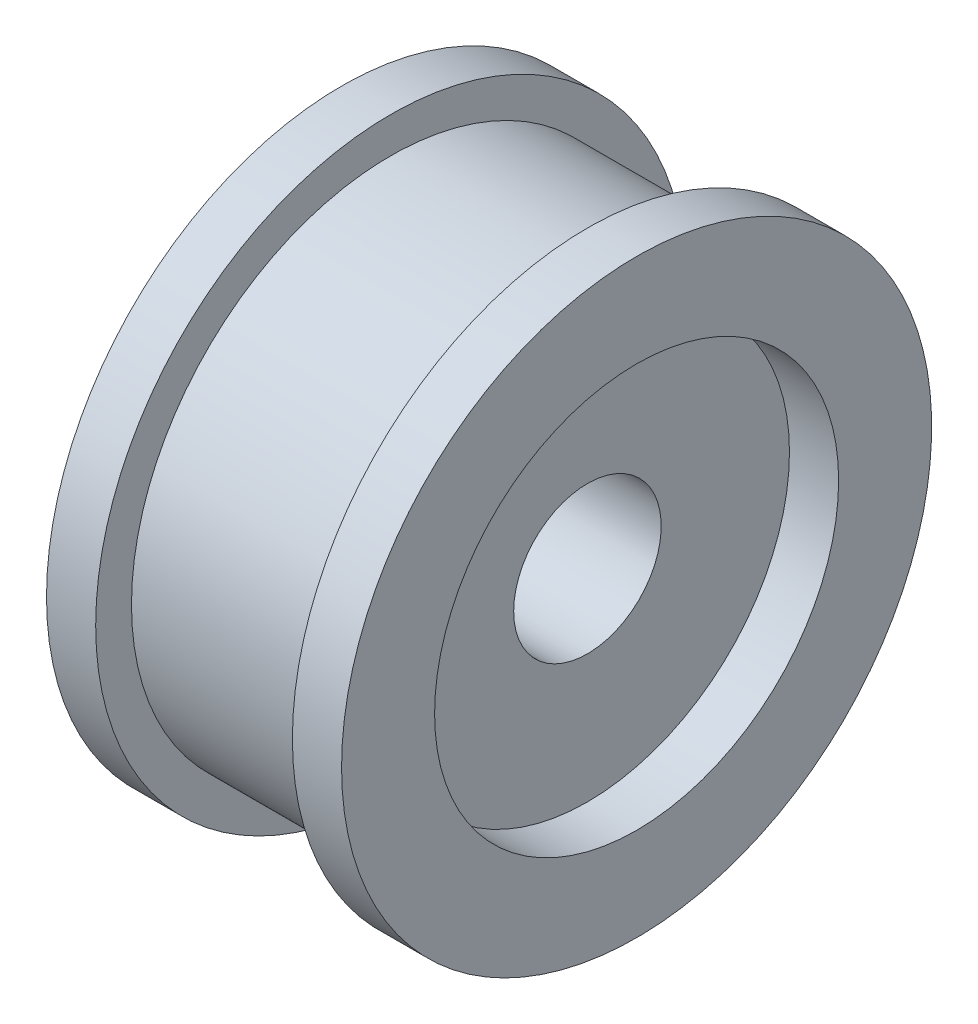
from build123d import *


with BuildPart() as part:
    # Sketch1 → Revolve1 (revolve)
    with BuildSketch(Plane(origin=(0, 0, 0), x_dir=(1, 0, 0), z_dir=(0, 1, 0))):
        Polygon((-2, 1.5), (2, 1.5), (2, 4.108076205), (3, 4.108076205), (3, 6), (2, 6), (2, 5.272000255), (-2, 5.272000255), (-2, 6), (-3, 6), (-3, 4.108076205), (-2, 4.108076205), align=None)
    revolve(axis=Axis((-9.525052047, 0, 0), (1, 0, 0)))


solid = part.part
